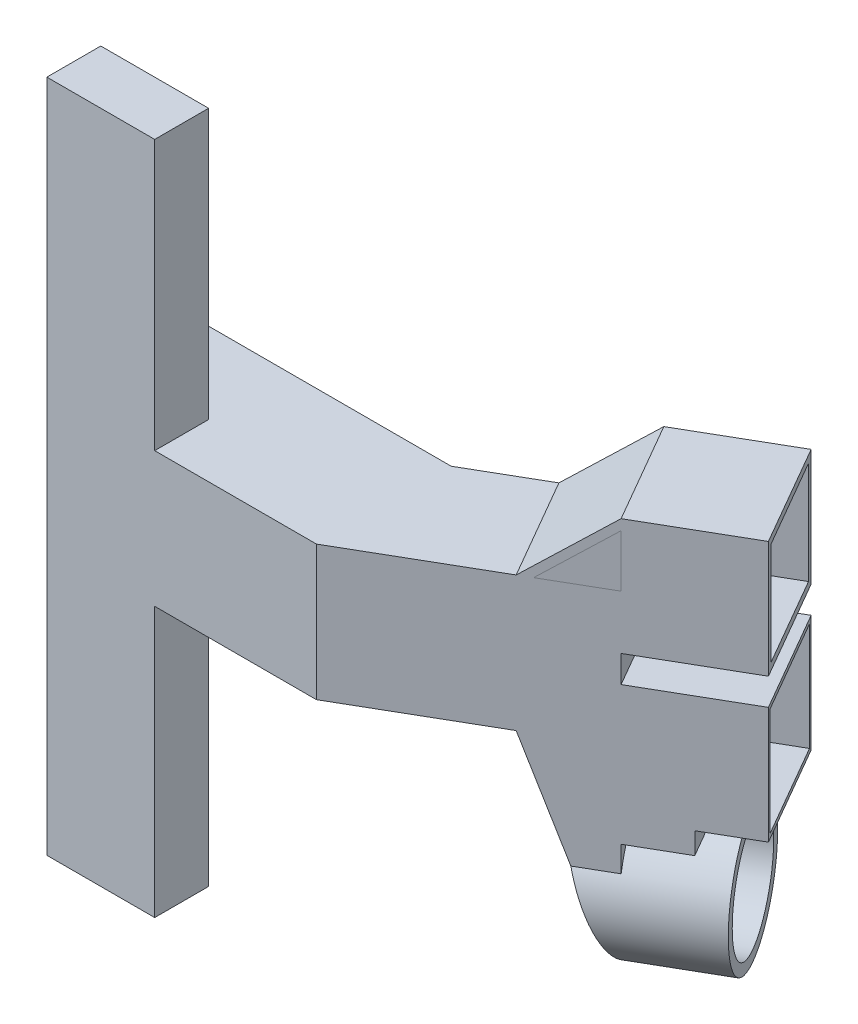
from build123d import *
from build123d.topology import SkipClean

# Parameters (mm, degrees)
SKETCH_1_W                = 100
SKETCH_1_H                = 50
EXTRUDE_1_DEPTH           = 50
EXTRUDE_2_DEPTH           = 50
SKETCH_3_W                = 43.301270189
SKETCH_3_H                = 43.301270189
SKETCH_3_W_2              = 40
SKETCH_3_H_2              = 40
EXTRUDE_3_DEPTH           = 40
SKETCH_4_W                = 43.301270189
SKETCH_4_H                = 43.301270189
SKETCH_4_W_2              = 38
SKETCH_4_H_2              = 38
EXTRUDE_4_DEPTH           = 40
SKETCH_6_R                = 25
SKETCH_6_R_2              = 21
EXTRUDE_5_DEPTH           = 30
EXTRUDE_START             = -11
SKETCH_8_R                = 21
SKETCH_8_R_2              = 5.5
EXTRUDE_6_DEPTH           = 10
EXTRUDE_7_REACH           = 263.92
EXTRUDE_10_REACH          = 263.92
SKETCH_10_W               = 20
SKETCH_10_H               = 8
EXTRUDE_11_REACH          = 263.92
EXTRUDE_12_DEPTH          = 2
EXTRUDE_13_DEPTH          = 2
CUT_EXTRUDE_1_DEPTH       = 238.05839295
EXTRUDE_14_REACH          = 214.453
CUT_EXTRUDE_2_REACH       = 264.283
SKETCH_17_W               = 40
SKETCH_17_H               = 40
CUT_EXTRUDE_START         = -5
CUT_EXTRUDE_3_DEPTH       = 33.301270189
CUT_EXTRUDE_START_2       = 14.349364905
CUT_EXTRUDE_4_DEPTH       = 28
CUT_EXTRUDE_5_DEPTH       = 5
CUT_EXTRUDE_START_3       = -20.776530706
CUT_EXTRUDE_6_OUTLINE_R   = 5.5
CUT_EXTRUDE_6_DEPTH       = 1.776530706
CUT_EXTRUDE_START_4       = 164.337567297
CUT_EXTRUDE_6_2_OUTLINE_R = 5.5
CUT_EXTRUDE_6_2_DEPTH     = 3.223469294
CUT_EXTRUDE_START_5       = 116
CUT_EXTRUDE_6_3_OUTLINE_W = 14
CUT_EXTRUDE_6_3_OUTLINE_H = 14
CUT_EXTRUDE_6_3_DEPTH     = 4.243643592
CUT_EXTRUDE_7_REACH       = 214.453
SKETCH_24_R               = 21
SKETCH_27_R               = 10
CUT_EXTRUDE_9_DEPTH       = 31
SKETCH_28_W               = 40
SKETCH_28_H               = 100
EXTRUDE_15_DEPTH          = 20


with BuildPart() as part:
    # 草图1 → 凸台-拉伸1 (new body)
    with BuildSketch(Plane.XY):
        with Locations((50, -25)):
            Rectangle(SKETCH_1_W, SKETCH_1_H)
    extrude(amount=-EXTRUDE_1_DEPTH)

    # 草图2 → 凸台-拉伸2 (add)
    with BuildSketch(Plane(origin=(0, 0, 0), x_dir=(1, 0, 0), z_dir=(0, 1, 0))):
        Polygon((150, 78.867513459), (100, 50), (100, 0), (171.650635095, 41.367513459), align=None)
    extrude(amount=-EXTRUDE_2_DEPTH)

    # 草图3 → 凸台-拉伸3 (add)
    with BuildSketch(Plane(origin=(146.650635095, 0, -84.668783649), x_dir=(-0.5000000000000012, 0, -0.866025403784438), z_dir=(0.8660254037844379, 0, -0.5000000000000011))):
        with Locations((-28.349364905, -51.650635095)):
            Rectangle(SKETCH_3_W, SKETCH_3_H)
        with Locations((-28.349364905, -51.650635095)):
            Rectangle(SKETCH_3_W_2, SKETCH_3_H_2, mode=Mode.SUBTRACT)
    extrude(amount=EXTRUDE_3_DEPTH)

    # 草图4 → 凸台-拉伸4 (add)
    with BuildSketch(Plane(origin=(146.650635095, 0, -84.668783649), x_dir=(-0.5000000000000012, 0, -0.866025403784438), z_dir=(0.8660254037844379, 0, -0.5000000000000011))):
        with Locations((-28.349364905, 1.650635095)):
            Rectangle(SKETCH_4_W, SKETCH_4_H)
        with Locations((-28.349364905, 1.650635095)):
            Rectangle(SKETCH_4_W_2, SKETCH_4_H_2, mode=Mode.SUBTRACT)
    extrude(amount=EXTRUDE_4_DEPTH)

    # 凸台-拉伸7: up to this face of the body (flat: up to its plane)
    extrude_7_end = Plane(part.part.faces().sort_by_distance((160.04661762, -25, -34.667930847))[0])
    # 草图9 → 凸台-拉伸7 (add, up to the picked face)
    with BuildSketch(Plane(origin=(3.349364905, 0, 5.801270189), x_dir=(-0.866025403784438, 0, 0.5000000000000012), z_dir=(-0.5000000000000012, 0, -0.866025403784438)), mode=Mode.PRIVATE) as extrude_7_sk1:
        Polygon((-140.838235643, -50), (-169.337567297, -128.301270189), (-169.337567297, -50), align=None)
    extrude_7_tool1 = split(extrude(extrude_7_sk1.sketch, amount=-EXTRUDE_7_REACH, mode=Mode.PRIVATE), bisect_by=extrude_7_end, keep=Keep.BOTH, mode=Mode.PRIVATE)


with BuildPart() as body_2:
    # 草图6 → 凸台-拉伸5 (new body)
    with BuildSketch(Plane(origin=(146.650635095, 0, -84.668783649), x_dir=(-0.5000000000000012, 0, -0.866025403784438), z_dir=(0.8660254037844379, 0, -0.5000000000000011))):
        with Locations(Location((-28.349364905, -103.301270189, 0), (0, 0, 180))):
            Circle(SKETCH_6_R)
        with Locations(Location((-28.349364905, -103.301270189, 0), (0, 0, 180))):
            Circle(SKETCH_6_R_2, mode=Mode.SUBTRACT)
    extrude(amount=EXTRUDE_5_DEPTH)

    # 草图8 → 凸台-拉伸6 (add)
    with BuildSketch(Plane(origin=(172.631397208, 0, -99.668783649), x_dir=(-0.5000000000000014, 0, -0.8660254037844379), z_dir=(0.8660254037844378, 0, -0.5000000000000013)).offset(EXTRUDE_START)):
        with Locations(Location((-28.349364905, -103.301270189, 0), (0, 0, 180))):
            Circle(SKETCH_8_R)
        with Locations((-28.349364905, -103.301270189)):
            Circle(SKETCH_8_R_2, mode=Mode.SUBTRACT)
    extrude(amount=-EXTRUDE_6_DEPTH)


with BuildPart() as part_1:
    add(part.part)

    add(body_2.part)  # 凸台-拉伸7 merges body 2
    add(extrude_7_tool1.solids().sort_by(Axis((141.772952, -76.100423, -74.117625), (0.5000000000000012, 0, 0.866025403784438)))[0])

    # 凸台-拉伸10: up to this face of the body (flat: up to its plane)
    extrude_10_end = Plane(part_1.part.faces().sort_by_distance((160.478884998, -31.541086273, -34.917500534))[0])
    # 草图10 → 凸台-拉伸10 (add, up to the picked face)
    with BuildSketch(Plane(origin=(3.349364905, 0, 5.801270189), x_dir=(-0.866025403784438, 0, 0.5000000000000012), z_dir=(-0.5000000000000012, 0, -0.866025403784438)), mode=Mode.PRIVATE) as extrude_10_sk1:
        with Locations((-179.337567297, -77.301270189)):
            Rectangle(SKETCH_10_W, SKETCH_10_H)
    extrude_10_tool1 = split(extrude(extrude_10_sk1.sketch, amount=-EXTRUDE_10_REACH, mode=Mode.PRIVATE), bisect_by=extrude_10_end, keep=Keep.BOTH, mode=Mode.PRIVATE)
    add(extrude_10_tool1.solids().sort_by(Axis((158.660254, -77.30127, -83.867513), (0.5000000000000012, 0, 0.866025403784438)))[0])

    # 凸台-拉伸11: up to this face of the body (flat: up to its plane)
    extrude_11_end = Plane(part_1.part.faces().sort_by_distance((160.836354474, -32.365908053, -35.123885632))[0])
    # 草图11 → 凸台-拉伸11 (add, up to the picked face)
    with BuildSketch(Plane(origin=(3.349364905, 0, 5.801270189), x_dir=(-0.866025403784438, 0, 0.5000000000000012), z_dir=(-0.5000000000000012, 0, -0.866025403784438)), mode=Mode.PRIVATE) as extrude_11_sk1:
        Polygon((-140.838235643, 0), (-169.337567297, 23.301270189), (-169.337567297, 19.42617797), (-145.577785781, 0), align=None)
    extrude_11_tool1 = split(extrude(extrude_11_sk1.sketch, amount=-EXTRUDE_11_REACH, mode=Mode.PRIVATE), bisect_by=extrude_11_end, keep=Keep.BOTH, mode=Mode.PRIVATE)
    add(extrude_11_tool1.solids().sort_by(Axis((138.654549, 10.711149, -72.317214), (0.5000000000000012, 0, 0.866025403784438)))[0])

    # 草图12 → 凸台-拉伸12 (add)
    with BuildSketch(Plane(origin=(3.349364905, 0, 5.801270189), x_dir=(-0.866025403784438, 0, 0.5000000000000012), z_dir=(-0.5000000000000012, 0, -0.866025403784438))):
        Polygon((-169.337567297, 19.42617797), (-169.337567297, 0), (-145.577785781, 0), align=None)
    extrude(amount=-EXTRUDE_12_DEPTH)

    # 草图15 → 切除-拉伸1 (cut, through all)
    with BuildSketch(Plane(origin=(172.631397208, 0, -99.668783649), x_dir=(-0.5000000000000014, 0, -0.8660254037844379), z_dir=(0.8660254037844378, 0, -0.5000000000000013))):
        with BuildLine():
            Line((-28.349364905, -128.301270189), (-6.698729811, -128.301270189))
            Line((-6.698729811, -128.301270189), (-6.698729811, -115.801270189))
            ThreePointArc((-6.698729811, -115.801270189), (-15.849364905, -124.951905284), (-28.349364905, -128.301270189))
        make_face()
        with BuildLine():
            Line((-50, -128.301270189), (-28.349364905, -128.301270189))
            ThreePointArc((-28.349364905, -128.301270189), (-40.849364905, -124.951905284), (-50, -115.801270189))
            Line((-50, -115.801270189), (-50, -128.301270189))
        make_face()
    extrude(amount=-CUT_EXTRUDE_1_DEPTH, mode=Mode.SUBTRACT)

    # 凸台-拉伸14: up to this plane
    with SkipClean():  # the faces are left unmerged after this step: merging them gives an invalid solid
        extrude_14_end = Plane(origin=(188.632725537, -50, 45.044993314), z_dir=(-0.8137976813493749, -0.342020143325663, 0.4698463103929563))
        # 草图16 → 凸台-拉伸14 (add, up to the surface)
        with BuildSketch(Plane(origin=(146.650635095, 0, -84.668783649), x_dir=(0.5000000000000014, 0, 0.8660254037844379), z_dir=(-0.8660254037844378, 0, 0.5000000000000013)), mode=Mode.PRIVATE) as extrude_14_sk1:
            with BuildLine():
                Line((6.698729811, -115.801270189), (6.698729811, -90.801270189))
                ThreePointArc((6.698729811, -90.801270189), (3.349364905, -103.301270189), (6.698729811, -115.801270189))
            make_face()
        extrude_14_tool1 = split(extrude(extrude_14_sk1.sketch, amount=EXTRUDE_14_REACH, mode=Mode.PRIVATE), bisect_by=extrude_14_end, keep=Keep.BOTH, mode=Mode.PRIVATE)
        add(extrude_14_tool1.solids().sort_by_distance((149.326125, -103.30127, -80.034698))[0])
        # 草图16 → 凸台-拉伸14 (add, up to the surface)
        with BuildSketch(Plane(origin=(146.650635095, 0, -84.668783649), x_dir=(0.5000000000000014, 0, 0.8660254037844379), z_dir=(-0.8660254037844378, 0, 0.5000000000000013)), mode=Mode.PRIVATE) as extrude_14_sk2:
            with BuildLine():
                Line((50, -90.801270189), (50, -115.801270189))
                ThreePointArc((50, -115.801270189), (53.349364905, -103.301270189), (50, -90.801270189))
            make_face()
        extrude_14_tool2 = split(extrude(extrude_14_sk2.sketch, amount=EXTRUDE_14_REACH, mode=Mode.PRIVATE), bisect_by=extrude_14_end, keep=Keep.BOTH, mode=Mode.PRIVATE)
        add(extrude_14_tool2.solids().sort_by_distance((172.32451, -103.30127, -40.200328))[0])

    # 切除-拉伸2: up to this plane
    with SkipClean():  # the faces are left unmerged after this step: merging them gives an invalid solid
        cut_extrude_2_end = Plane(origin=(22.5, -156.554672299, 38.97114317), z_dir=(0.5000000000000017, 0, 0.8660254037844378))
        # 草图17 → 切除-拉伸2 (cut, up to the surface)
        with BuildSketch(Plane.ZY, mode=Mode.PRIVATE) as cut_extrude_2_sk1:
            with Locations((-25, -25)):
                Rectangle(SKETCH_17_W, SKETCH_17_H)
        cut_extrude_2_tool1 = split(extrude(cut_extrude_2_sk1.sketch, amount=-CUT_EXTRUDE_2_REACH, mode=Mode.PRIVATE), bisect_by=cut_extrude_2_end, keep=Keep.BOTH, mode=Mode.PRIVATE)
        add(cut_extrude_2_tool1.solids().sort_by_distance((0, -25, -25))[0], mode=Mode.SUBTRACT)

    # 草图19 → 切除-拉伸3 (cut)
    with SkipClean():  # the faces are left unmerged after this step: merging them gives an invalid solid
        with BuildSketch(Plane(origin=(3.349364905, 0, 5.801270189), x_dir=(-0.866025403784438, 0, 0.5000000000000012), z_dir=(-0.5000000000000012, 0, -0.866025403784438)).offset(CUT_EXTRUDE_START)):
            Polygon((-164.337567297, -5), (-164.337567297, -99.944861091), (-144.339273334, -45), (-116.602540378, -45), (-116.602540378, -5), align=None)
        extrude(amount=-CUT_EXTRUDE_3_DEPTH, mode=Mode.SUBTRACT)

    # 切除-拉伸4: read off the stored shape, not the designer's step
    # 切除-拉伸4 outline → 切除-拉伸4 (cut)
    with SkipClean():  # the faces are left unmerged after this step: merging them gives an invalid solid
        with BuildSketch(Plane(origin=(0, 0, 0), x_dir=(0.866025403784438, 0, -0.500000000000001), z_dir=(0.500000000000001, 0, 0.866025403784438)).offset(CUT_EXTRUDE_START_2)):
            Polygon((164.337567297, -17.349364905), (169.337567297, -17.349364905), (169.337567297, 0), (153.477036011, 0), (147.361632983, -5), (164.337567297, -5), align=None)
        extrude(amount=CUT_EXTRUDE_4_DEPTH, mode=Mode.SUBTRACT)

    # 切除-拉伸5: read off the stored shape, not the designer's step
    # 切除-拉伸5 outline → 切除-拉伸5 (cut)
    with SkipClean():  # the faces are left unmerged after this step: merging them gives an invalid solid
        with BuildSketch(Plane(origin=(146.650635095, 0, -84.668783649), x_dir=(-0.5000000000000012, 0, -0.866025403784438), z_dir=(0.8660254037844379, 0, -0.5000000000000011)).offset(CUT_EXTRUDE_START)):
            Polygon((-13.349364905, -66.650635095), (-13.349364905, -36.650635095), (-43.349364905, -36.650635095), (-43.349364905, -45), (-43.349364905, -66.650635095), align=None)
        extrude(amount=CUT_EXTRUDE_5_DEPTH, mode=Mode.SUBTRACT)

    # 切除-拉伸6: read off the stored shape, not the designer's step
    # 切除-拉伸6 outline → 切除-拉伸6 (cut)
    with SkipClean():  # the faces are left unmerged after this step: merging them gives an invalid solid
        with BuildSketch(Plane(origin=(163.105117767, 0, -94.168783649), x_dir=(-0.5000000000000017, 0, -0.8660254037844378), z_dir=(0.8660254037844377, 0, -0.5000000000000016)).offset(CUT_EXTRUDE_START_3)):
            with Locations((-28.349364905, -103.301270189)):
                Circle(CUT_EXTRUDE_6_OUTLINE_R)
        extrude(amount=CUT_EXTRUDE_6_DEPTH, mode=Mode.SUBTRACT)

    # Cut-Extrude 6 2 outline → Cut-Extrude 6 2 (cut)
    with SkipClean():  # the faces are left unmerged after this step: merging them gives an invalid solid
        with BuildSketch(Plane(origin=(0, 0, 0), x_dir=(0.5000000000000016, 0, 0.8660254037844377), z_dir=(0.8660254037844377, 0, -0.5000000000000018)).offset(CUT_EXTRUDE_START_4)):
            with Locations((28.349364905, 103.301270189)):
                Circle(CUT_EXTRUDE_6_2_OUTLINE_R)
        extrude(amount=CUT_EXTRUDE_6_2_DEPTH, mode=Mode.SUBTRACT)

    # Cut-Extrude 6 3 outline → Cut-Extrude 6 3 (add)
    with SkipClean():  # the faces are left unmerged after this step: merging them gives an invalid solid
        with BuildSketch(Plane(origin=(0, 0, 0), x_dir=(0.5811482890195767, -0.4789400655085298, 0.6579385076284131), z_dir=(0.8137976813493747, 0.342020143325664, -0.46984631039295593)).offset(CUT_EXTRUDE_START_5)):
            with Locations((103, 118)):
                Rectangle(CUT_EXTRUDE_6_3_OUTLINE_W, CUT_EXTRUDE_6_3_OUTLINE_H)
        extrude(amount=CUT_EXTRUDE_6_3_DEPTH)

    # 切除-拉伸7: up to this face of the body (flat: up to its plane)
    cut_extrude_7_end = Plane(part_1.part.faces().sort_by_distance((147.681341703, -71.975169853, -52.523277291))[0])
    # 草图24 → 切除-拉伸7 (cut, up to the picked face)
    with BuildSketch(Plane(origin=(146.650635095, 0, -84.668783649), x_dir=(-0.5000000000000013, 0, -0.8660254037844379), z_dir=(0.8660254037844378, 0, -0.5000000000000012)), mode=Mode.PRIVATE) as cut_extrude_7_sk1:
        with Locations(Location((-28.349364905, -103.301270189, 0), (0, 0, 209.625730133))):
            Circle(SKETCH_24_R)
    cut_extrude_7_tool1 = split(extrude(cut_extrude_7_sk1.sketch, amount=-CUT_EXTRUDE_7_REACH, mode=Mode.PRIVATE), bisect_by=cut_extrude_7_end, keep=Keep.BOTH, mode=Mode.PRIVATE)
    add(cut_extrude_7_tool1.solids().sort_by(Axis((160.825318, -103.30127, -60.117513), (-0.8660254037844378, 0, 0.5000000000000012)))[0], mode=Mode.SUBTRACT)

    # 草图27 → 切除-拉伸9 (cut)
    with SkipClean():  # the faces are left unmerged after this step: merging them gives an invalid solid
        with BuildSketch(Plane(origin=(154.444863729, 0, -89.168783649), x_dir=(0.5000000000000017, 0, 0.8660254037844378), z_dir=(-0.8660254037844377, 0, 0.5000000000000016))):
            with Locations(Location((28.349364905, -103.301270189, 0), (0, 0, 270))):
                Circle(SKETCH_27_R)
        extrude(amount=CUT_EXTRUDE_9_DEPTH, mode=Mode.SUBTRACT)

    # 草图28 → 凸台-拉伸15 (add)
    with SkipClean():  # the faces are left unmerged after this step: merging them gives an invalid solid
        with BuildSketch(Plane.XY):
            with Locations((20, 50)):
                Rectangle(SKETCH_28_W, SKETCH_28_H)
            with Locations((20, -100)):
                Rectangle(SKETCH_28_W, SKETCH_28_H)
        extrude(amount=-EXTRUDE_15_DEPTH)


with BuildPart() as body_2_2:
    # 草图14 → 凸台-拉伸13 (new body)
    with BuildSketch(Plane(origin=(25, 0, 43.301270189), x_dir=(0.8660254037844377, 0, -0.5000000000000018), z_dir=(0.5000000000000018, 0, 0.8660254037844377))):
        Polygon((169.337567297, 19.42617797), (145.577785781, 0), (169.337567297, 0), align=None)
    extrude(amount=-EXTRUDE_13_DEPTH)


solid = Compound([part_1.part, body_2_2.part])
